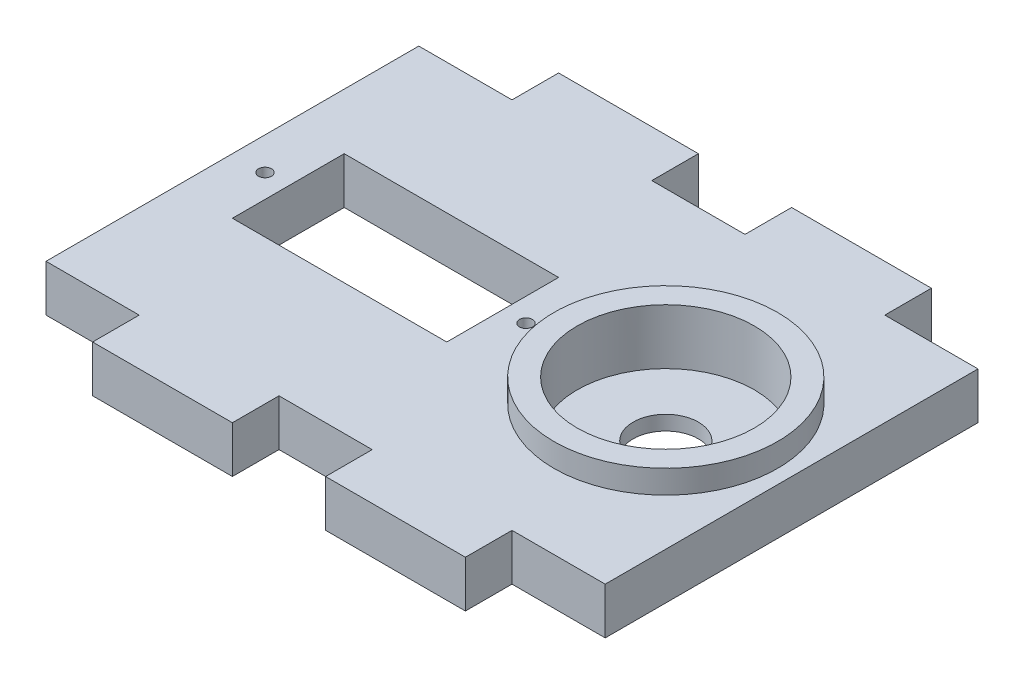
from build123d import *

# Parameters (mm, degrees)
SKETCH1_R           = 0.7
SKETCH1_R_2         = 9.5
SKETCH1_W           = 23
SKETCH1_H           = 12
BOSS_EXTRUDE1_DEPTH = 5
SKETCH2_R           = 12
SKETCH2_R_2         = 9.5
BOSS_EXTRUDE2_DEPTH = 2.5
SKETCH3_R           = 9.5
SKETCH3_R_2         = 3.5
BOSS_EXTRUDE3_DEPTH = 1.56


with BuildPart() as part:
    # Sketch1 → Boss-Extrude1 (new body)
    with BuildSketch(Plane(origin=(0, 0, 0), x_dir=(1, 0, 0), z_dir=(0, 1, 0))):
        Polygon((7.5, 20), (17.5, 20), (17.5, 25), (32.5, 25), (32.5, 20), (42.5, 20), (42.5, -20), (32.5, -20), (32.5, -25), (17.5, -25), (17.5, -20), (7.5, -20), (7.5, -25), (-7.5, -25), (-7.5, -20), (-17.5, -20), (-17.5, 20), (-7.5, 20), (-7.5, 25), (7.5, 25), align=None)
        with Locations((-14, 0)):
            Circle(SKETCH1_R, mode=Mode.SUBTRACT)
        with Locations((14, 0)):
            Circle(SKETCH1_R, mode=Mode.SUBTRACT)
        with Locations((29, 0)):
            Circle(SKETCH1_R_2, mode=Mode.SUBTRACT)
        Rectangle(SKETCH1_W, SKETCH1_H, mode=Mode.SUBTRACT)
    extrude(amount=BOSS_EXTRUDE1_DEPTH)

    # Sketch2 → Boss-Extrude2 (add)
    with BuildSketch(Plane(origin=(0, 5, 0), x_dir=(1, 0, 0), z_dir=(0, 1, 0))):
        with Locations((29, 0)):
            Circle(SKETCH2_R)
        with Locations((29, 0)):
            Circle(SKETCH2_R_2, mode=Mode.SUBTRACT)
    extrude(amount=BOSS_EXTRUDE2_DEPTH)

    # Sketch3 → Boss-Extrude3 (add)
    with BuildSketch(Plane.XZ):
        with Locations((29, 0)):
            Circle(SKETCH3_R)
        with Locations((29, 0)):
            Circle(SKETCH3_R_2, mode=Mode.SUBTRACT)
    extrude(amount=-BOSS_EXTRUDE3_DEPTH)


solid = part.part
